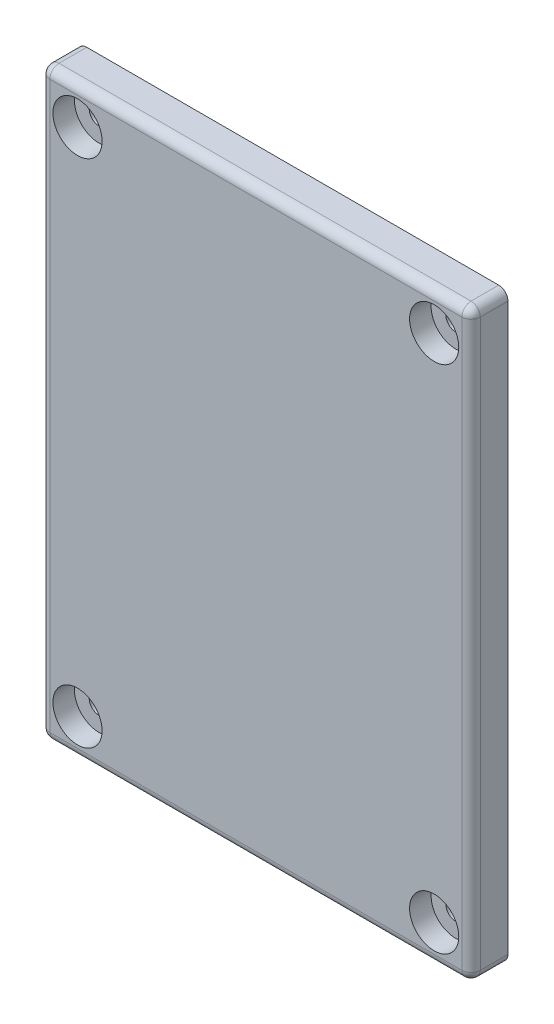
from build123d import *

# Parameters (mm, degrees)
SKETCH_1_W          = 70
SKETCH_1_H          = 95
EXTRUDE_1_DEPTH     = 6
SKETCH_2_R          = 4
CUT_EXTRUDE_1_DEPTH = 3.5
SKETCH_3_R          = 1.6
CUT_EXTRUDE_2_DEPTH = 65.065587298
SHELL_1_DEPTH       = 3
FILLET_1_R          = 1.5


# Read off the part's stored shape, not the designer's step: 抽壳1
with BuildPart() as part:
    # 草图1 → 凸台-拉伸1 (new body)
    with BuildSketch(Plane.XY):
        with Locations((1.898047722, -4.528199566)):
            Rectangle(SKETCH_1_W, SKETCH_1_H)
    extrude(amount=EXTRUDE_1_DEPTH)

    # 草图2 → 切除-拉伸1 (cut)
    with BuildSketch(Plane.XY.offset(6)):
        with Locations((30.898047722, 36.971800434)):
            Circle(SKETCH_2_R)
        with Locations((-27.101952278, 36.971800434)):
            Circle(SKETCH_2_R)
        with Locations((30.898047722, -46.028199566)):
            Circle(SKETCH_2_R)
        with Locations((-27.101952278, -46.028199566)):
            Circle(SKETCH_2_R)
    extrude(amount=-CUT_EXTRUDE_1_DEPTH, mode=Mode.SUBTRACT)

    # 草图3 → 切除-拉伸2 (cut, through all)
    with BuildSketch(Plane.XY.offset(6)):
        with Locations((30.898047722, 36.971800434)):
            Circle(SKETCH_3_R)
        with Locations((-27.101952278, 36.971800434)):
            Circle(SKETCH_3_R)
        with Locations((-27.101952278, -46.028199566)):
            Circle(SKETCH_3_R)
        with Locations((30.898047722, -46.028199566)):
            Circle(SKETCH_3_R)
    extrude(amount=-CUT_EXTRUDE_2_DEPTH, mode=Mode.SUBTRACT)

    # 抽壳1 outline → 抽壳1 (cut)
    with BuildSketch(Plane.XY):
        with BuildLine():
            Line((-30.101952278, 30.647245114), (-30.101952278, -39.703644246))
            ThreePointArc((-30.101952278, -39.703644246), (-22.152204809, -41.078452098), (-20.777396957, -49.028199566))
            Line((-20.777396957, -49.028199566), (24.573492402, -49.028199566))
            ThreePointArc((24.573492402, -49.028199566), (25.948300254, -41.078452098), (33.898047722, -39.703644246))
            Line((33.898047722, -39.703644246), (33.898047722, 30.647245114))
            ThreePointArc((33.898047722, 30.647245114), (25.948300254, 32.022052966), (24.573492402, 39.971800434))
            Line((24.573492402, 39.971800434), (-20.777396957, 39.971800434))
            ThreePointArc((-20.777396957, 39.971800434), (-22.152204809, 32.022052966), (-30.101952278, 30.647245114))
        make_face()
    extrude(amount=SHELL_1_DEPTH, mode=Mode.SUBTRACT)

    # 圆角1
    fillet_1_edges = [part.edges().sort_by_distance(p)[0] for p in [
        (36.898047722, -4.528199566, 6),
        (1.898047722, 42.971800434, 6),
        (-33.101952278, -4.528199566, 6),
        (-33.101952278, 42.971800434, 3),
        (36.898047722, 42.971800434, 3),
        (36.898047722, -52.028199566, 3),
        (-33.101952278, -52.028199566, 3),
        (1.898047722, -52.028199566, 6),
    ]]
    fillet(fillet_1_edges, radius=FILLET_1_R)


solid = part.part
